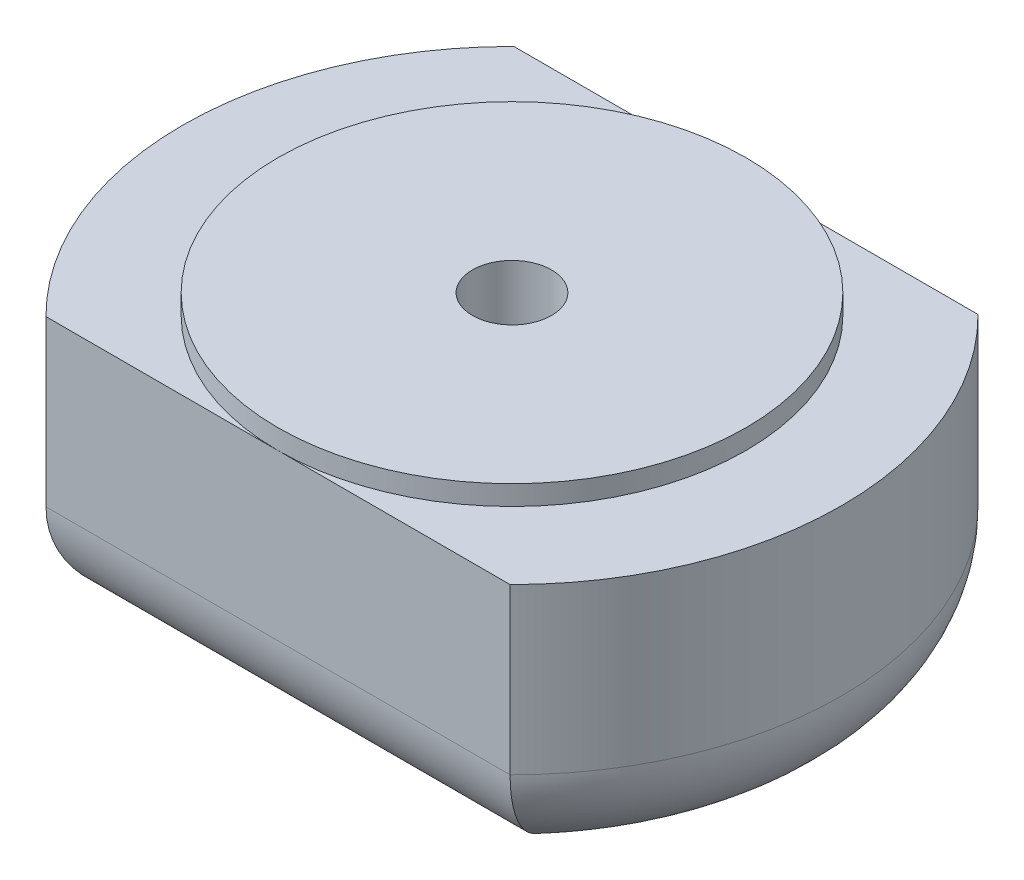
from build123d import *

# Parameters (mm, degrees)
SKETCH_1_R           = 5
EXTRUDE_1_DEPTH      = 4
SKETCH_2_R           = 3.55
EXTRUDE_2_DEPTH      = 0.3
SKETCH_3_R           = 0.6
CUT_EXTRUDE_1_DEPTH  = 9.275868534
SKETCH_4_OUTSIDE_W   = 14.956
SKETCH_4_OUTSIDE_H   = 14.956
SKETCH_4_OUTSIDE_W_2 = 10
SKETCH_4_OUTSIDE_H_2 = 7.1
CUT_EXTRUDE_2_DEPTH  = 9.124038405
FILLET_1_R           = 1.5


with BuildPart() as part:
    # 草图1 → 凸台-拉伸1 (new body)
    with BuildSketch(Plane(origin=(0, 0, 0), x_dir=(1, 0, 0), z_dir=(0, 1, 0))):
        with Locations(Location((0, 0, 0), (0, 0, 270))):
            Circle(SKETCH_1_R)
    extrude(amount=EXTRUDE_1_DEPTH)

    # 草图2 → 凸台-拉伸2 (add)
    with BuildSketch(Plane(origin=(0, 4, 0), x_dir=(1, 0, 0), z_dir=(0, 1, 0))):
        with Locations(Location((0, 0, 0), (0, 0, 270))):
            Circle(SKETCH_2_R)
    extrude(amount=EXTRUDE_2_DEPTH)

    # 草图3 → 切除-拉伸1 (cut, through all)
    with BuildSketch(Plane(origin=(0, 4.3, 0), x_dir=(1, 0, 0), z_dir=(0, 1, 0))):
        with Locations(Location((0, 0, 0), (0, 0, 270))):
            Circle(SKETCH_3_R)
    extrude(amount=-CUT_EXTRUDE_1_DEPTH, mode=Mode.SUBTRACT)

    # 草图4 outside → 切除-拉伸2 (cut, through all)
    with BuildSketch(Plane(origin=(0, 4, 0), x_dir=(1, 0, 0), z_dir=(0, 1, 0))):
        Rectangle(SKETCH_4_OUTSIDE_W, SKETCH_4_OUTSIDE_H)
        Rectangle(SKETCH_4_OUTSIDE_W_2, SKETCH_4_OUTSIDE_H_2, mode=Mode.SUBTRACT)
    extrude(amount=-CUT_EXTRUDE_2_DEPTH, mode=Mode.SUBTRACT)

    # 圆角1
    # the kernel refuses this fillet: 1.5 mm, written as the material it takes off along each edge
    with BuildSketch(Plane(origin=(0, 0, 0), x_dir=(-0.03098871975283517, 0, 0.9995197342964671), z_dir=(0.9995197342964671, 0, 0.03098871975283517))) as fillet_1_piece_1:
        with BuildLine():
            CenterArc((5 - FILLET_1_R, -FILLET_1_R), FILLET_1_R, 0, 90)
            Line((5 - FILLET_1_R, 0), (5, 0))
            Line((5, 0), (5, -FILLET_1_R))
        make_face()
    revolve(axis=Axis((0, 0, 0), (0, -1, 0)), revolution_arc=176.4483857, mode=Mode.SUBTRACT)
    with BuildSketch(Plane(origin=(-7.271008378, 0, -3.55), x_dir=(0, 1, 0), z_dir=(1, 0, 0)), Plane(origin=(7.271008378, 0, 3.55), x_dir=(0, 1, 0), z_dir=(-1, 0, 0))) as fillet_1_piece_2:
        with BuildLine():
            CenterArc((FILLET_1_R, FILLET_1_R), FILLET_1_R, 180, 90)
            Line((0, FILLET_1_R), (0, 0))
            Line((0, 0), (FILLET_1_R, 0))
        make_face()
    extrude(amount=14.542016757, mode=Mode.SUBTRACT)
    with BuildSketch(Plane(origin=(0, 0, 0), x_dir=(0.030988719752834452, 0, 0.9995197342964671), z_dir=(-0.9995197342964671, 0, 0.030988719752834452))) as fillet_1_piece_3:
        with BuildLine():
            CenterArc((5 - FILLET_1_R, FILLET_1_R), FILLET_1_R, 270, 90)
            Line((5 - FILLET_1_R, 0), (5, 0))
            Line((5, 0), (5, FILLET_1_R))
        make_face()
    revolve(axis=Axis((0, 0, 0), (0, 1, 0)), revolution_arc=176.4483857, mode=Mode.SUBTRACT)


solid = part.part
